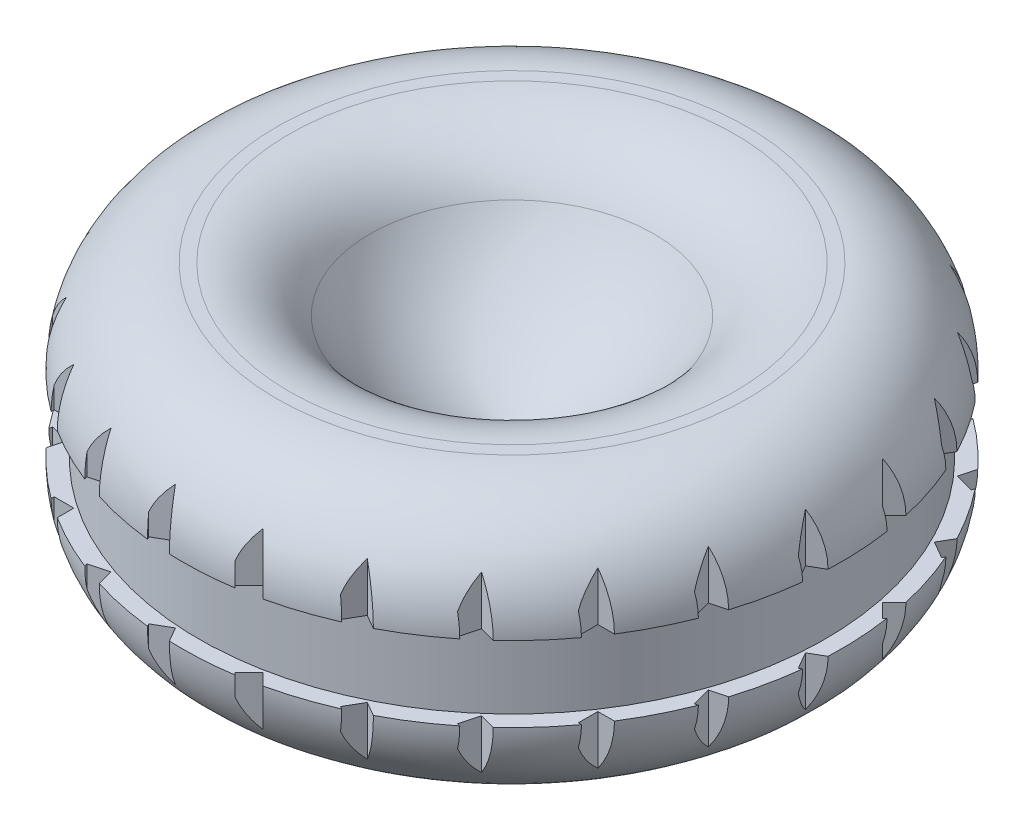
from build123d import *

# Parameters (mm, degrees)
SKETCH1_R                = 175
SKETCH1_R_2              = 6
BOSS_EXTRUDE1_DEPTH      = 140
FILLET4_R                = 50
SKETCH2_W                = 8.82126667
SKETCH2_H                = 40
SKETCH5_W                = 10.739457823
SKETCH5_H                = 10.396834474
CUT_EXTRUDE4_DEPTH       = 102
CIRPATTERN1_START        = -103.927560019
CIRPATTERN1_OUTLINE_W    = 20.879049746
CIRPATTERN1_OUTLINE_H    = 28
CIRPATTERN1_DEPTH        = 10.396834474
CIRPATTERN1_START_2      = 93.530725545
CIRPATTERN1_2_OUTLINE_W  = 9.879049746
CIRPATTERN1_2_OUTLINE_H  = 28
CIRPATTERN1_2_DEPTH      = 10.396834474
CIRPATTERN1_START_3      = -147.908767196
CIRPATTERN1_3_OUTLINE_W  = 10.396834474
CIRPATTERN1_3_OUTLINE_H  = 28
CIRPATTERN1_3_DEPTH      = 8.787816942
CIRPATTERN1_START_4      = 139.120950254
CIRPATTERN1_4_OUTLINE_W  = 10.396834474
CIRPATTERN1_4_OUTLINE_H  = 28
CIRPATTERN1_4_DEPTH      = 8.787816935
CIRPATTERN1_5_OUTLINE_W  = 32.879049746
CIRPATTERN1_5_OUTLINE_H  = 28
CIRPATTERN1_5_DEPTH      = 10.396834474
CIRPATTERN1_6_OUTLINE_W  = 31.879049746
CIRPATTERN1_6_OUTLINE_H  = 28
CIRPATTERN1_6_DEPTH      = 10.396834474
CIRPATTERN1_7_OUTLINE_W  = 10.396834474
CIRPATTERN1_7_OUTLINE_H  = 28
CIRPATTERN1_7_DEPTH      = 8.787816942
CIRPATTERN1_8_OUTLINE_W  = 10.396834474
CIRPATTERN1_8_OUTLINE_H  = 28
CIRPATTERN1_8_DEPTH      = 8.787816935
CIRPATTERN1_9_OUTLINE_W  = 29.879049746
CIRPATTERN1_9_OUTLINE_H  = 28
CIRPATTERN1_9_DEPTH      = 10.396834474
CIRPATTERN1_10_OUTLINE_W = 28.879049746
CIRPATTERN1_10_OUTLINE_H = 28
CIRPATTERN1_10_DEPTH     = 10.396834474
CIRPATTERN1_11_OUTLINE_W = 10.396834474
CIRPATTERN1_11_OUTLINE_H = 28
CIRPATTERN1_11_DEPTH     = 8.787816942
CIRPATTERN1_12_OUTLINE_W = 10.396834474
CIRPATTERN1_12_OUTLINE_H = 28
CIRPATTERN1_12_DEPTH     = 8.787816935
CIRPATTERN1_13_OUTLINE_W = 34.879049746
CIRPATTERN1_13_OUTLINE_H = 28
CIRPATTERN1_13_DEPTH     = 10.396834474
CIRPATTERN1_14_OUTLINE_W = 14.879049746
CIRPATTERN1_14_OUTLINE_H = 28
CIRPATTERN1_14_DEPTH     = 10.396834474
CIRPATTERN1_15_OUTLINE_W = 10.396834474
CIRPATTERN1_15_OUTLINE_H = 28
CIRPATTERN1_15_DEPTH     = 8.787816942
CIRPATTERN1_16_OUTLINE_W = 10.396834474
CIRPATTERN1_16_OUTLINE_H = 28
CIRPATTERN1_16_DEPTH     = 8.787816935
CIRPATTERN1_17_OUTLINE_W = 33.879049746
CIRPATTERN1_17_OUTLINE_H = 28
CIRPATTERN1_17_DEPTH     = 10.396834474
CIRPATTERN1_18_OUTLINE_W = 9.879049746
CIRPATTERN1_18_OUTLINE_H = 28
CIRPATTERN1_18_DEPTH     = 10.396834474
CIRPATTERN1_19_OUTLINE_W = 10.396834474
CIRPATTERN1_19_OUTLINE_H = 28
CIRPATTERN1_19_DEPTH     = 8.787816942
CIRPATTERN1_20_OUTLINE_W = 10.396834474
CIRPATTERN1_20_OUTLINE_H = 28
CIRPATTERN1_20_DEPTH     = 8.787816935
CIRPATTERN1_21_OUTLINE_W = 28
CIRPATTERN1_21_OUTLINE_H = 23.879049746
CIRPATTERN1_21_DEPTH     = 10.396834474
CIRPATTERN1_22_OUTLINE_W = 28
CIRPATTERN1_22_OUTLINE_H = 9.879049746
CIRPATTERN1_22_DEPTH     = 10.396834474
CIRPATTERN1_START_5      = -147.90876718
CIRPATTERN1_23_OUTLINE_W = 28
CIRPATTERN1_23_OUTLINE_H = 10.396834474
CIRPATTERN1_23_DEPTH     = 8.787816926
FILLET5_R                = 50


# Read off the part's stored shape, not the designer's step: CirPattern1
with BuildPart() as part:
    # Sketch1 → Boss-Extrude1 (new body)
    with BuildSketch(Plane(origin=(0, 0, 0), x_dir=(1, 0, 0), z_dir=(0, 1, 0))):
        with Locations(Location((0, 0, 0), (0, 0, 270))):
            Circle(SKETCH1_R)
        with Locations(Location((0, 0, 0), (0, 0, 270))):
            Circle(SKETCH1_R_2, mode=Mode.SUBTRACT)
    extrude(amount=BOSS_EXTRUDE1_DEPTH)

    # Fillet4
    fillet4_edges = [part.edges().sort_by_distance(p)[0] for p in [
        (0, 0, -175),
        (0, 140, -175),
    ]]
    fillet(fillet4_edges, radius=FILLET4_R)

    # Sketch2 → Cut-Revolve1 (revolve, cut)
    with BuildSketch(Plane(origin=(0, 0, 0), x_dir=(0, 0, -1), z_dir=(1, 0, 0)), mode=Mode.PRIVATE) as cut_revolve1_sk:
        with Locations((170.589366665, 70)):
            Rectangle(SKETCH2_W, SKETCH2_H)
    revolve(cut_revolve1_sk.sketch.rotate(Axis((0, 0, 0), (0, 1, 0)), 180), axis=Axis((0, 0, 0), (0, 1, 0)), mode=Mode.SUBTRACT)

    # Sketch5 → Cut-Extrude4 (cut, symmetric)
    with BuildSketch(Plane(origin=(0, 50, 0), x_dir=(1, 0, 0), z_dir=(0, 1, 0))):
        with Locations((144.490679166, -98.729142782)):
            Rectangle(SKETCH5_W, SKETCH5_H)
    extrude(amount=CUT_EXTRUDE4_DEPTH, both=True, mode=Mode.SUBTRACT)

    # CirPattern1 outline → CirPattern1 (cut)
    with BuildSketch(Plane(origin=(0, 0, 0), x_dir=(0.9659258262890682, 0, -0.2588190451025211), z_dir=(0.2588190451025211, 0, 0.9659258262890682)).offset(CIRPATTERN1_START)):
        with Locations((-149.560475127, 104)):
            Rectangle(CIRPATTERN1_OUTLINE_W, CIRPATTERN1_OUTLINE_H)
        with Locations((-149.560475127, 36)):
            Rectangle(CIRPATTERN1_OUTLINE_W, CIRPATTERN1_OUTLINE_H)
    extrude(amount=CIRPATTERN1_DEPTH, mode=Mode.SUBTRACT)

    # CirPattern1 2 outline → CirPattern1 2 (cut)
    with BuildSketch(Plane(origin=(0, 0, 0), x_dir=(0.9659258262890682, 0, -0.2588190451025211), z_dir=(0.2588190451025211, 0, 0.9659258262890682)).offset(CIRPATTERN1_START_2)):
        with Locations((144.060475127, 104)):
            Rectangle(CIRPATTERN1_2_OUTLINE_W, CIRPATTERN1_2_OUTLINE_H)
        with Locations((144.060475127, 36)):
            Rectangle(CIRPATTERN1_2_OUTLINE_W, CIRPATTERN1_2_OUTLINE_H)
    extrude(amount=CIRPATTERN1_2_DEPTH, mode=Mode.SUBTRACT)

    # CirPattern1 3 outline → CirPattern1 3 (cut)
    with BuildSketch(Plane(origin=(0, 0, 0), x_dir=(0.9659258262890682, 0, -0.2588190451025211), z_dir=(0.2588190451025211, 0, 0.9659258262890682)).offset(CIRPATTERN1_START_3)):
        with Locations((98.729142782, 104)):
            Rectangle(CIRPATTERN1_3_OUTLINE_W, CIRPATTERN1_3_OUTLINE_H)
        with Locations((98.729142782, 36)):
            Rectangle(CIRPATTERN1_3_OUTLINE_W, CIRPATTERN1_3_OUTLINE_H)
    extrude(amount=CIRPATTERN1_3_DEPTH, mode=Mode.SUBTRACT)

    # CirPattern1 4 outline → CirPattern1 4 (cut)
    with BuildSketch(Plane(origin=(0, 0, 0), x_dir=(0.9659258262890682, 0, -0.2588190451025211), z_dir=(0.2588190451025211, 0, 0.9659258262890682)).offset(CIRPATTERN1_START_4)):
        with Locations((-98.729142782, 104)):
            Rectangle(CIRPATTERN1_4_OUTLINE_W, CIRPATTERN1_4_OUTLINE_H)
        with Locations((-98.729142782, 36)):
            Rectangle(CIRPATTERN1_4_OUTLINE_W, CIRPATTERN1_4_OUTLINE_H)
    extrude(amount=CIRPATTERN1_4_DEPTH, mode=Mode.SUBTRACT)

    # CirPattern1 5 outline → CirPattern1 5 (cut)
    with BuildSketch(Plane(origin=(0, 0, 0), x_dir=(0.9659258262890716, 0, 0.25881904510250797), z_dir=(0.25881904510250797, 0, -0.9659258262890718)).offset(CIRPATTERN1_START_2)):
        with Locations((-155.560475127, -104)):
            Rectangle(CIRPATTERN1_5_OUTLINE_W, CIRPATTERN1_5_OUTLINE_H)
        with Locations((-155.560475127, -36)):
            Rectangle(CIRPATTERN1_5_OUTLINE_W, CIRPATTERN1_5_OUTLINE_H)
    extrude(amount=CIRPATTERN1_5_DEPTH, mode=Mode.SUBTRACT)

    # CirPattern1 6 outline → CirPattern1 6 (cut)
    with BuildSketch(Plane(origin=(0, 0, 0), x_dir=(0.9659258262890716, 0, 0.25881904510250797), z_dir=(0.25881904510250797, 0, -0.9659258262890718)).offset(CIRPATTERN1_START)):
        with Locations((155.060475127, -104)):
            Rectangle(CIRPATTERN1_6_OUTLINE_W, CIRPATTERN1_6_OUTLINE_H)
        with Locations((155.060475127, -36)):
            Rectangle(CIRPATTERN1_6_OUTLINE_W, CIRPATTERN1_6_OUTLINE_H)
    extrude(amount=CIRPATTERN1_6_DEPTH, mode=Mode.SUBTRACT)

    # CirPattern1 7 outline → CirPattern1 7 (cut)
    with BuildSketch(Plane(origin=(0, 0, 0), x_dir=(0.9659258262890716, 0, 0.25881904510250797), z_dir=(0.25881904510250797, 0, -0.9659258262890718)).offset(CIRPATTERN1_START_3)):
        with Locations((-98.729142782, -104)):
            Rectangle(CIRPATTERN1_7_OUTLINE_W, CIRPATTERN1_7_OUTLINE_H)
        with Locations((-98.729142782, -36)):
            Rectangle(CIRPATTERN1_7_OUTLINE_W, CIRPATTERN1_7_OUTLINE_H)
    extrude(amount=CIRPATTERN1_7_DEPTH, mode=Mode.SUBTRACT)

    # CirPattern1 8 outline → CirPattern1 8 (cut)
    with BuildSketch(Plane(origin=(0, 0, 0), x_dir=(0.9659258262890716, 0, 0.25881904510250797), z_dir=(0.25881904510250797, 0, -0.9659258262890718)).offset(CIRPATTERN1_START_4)):
        with Locations((98.729142782, -104)):
            Rectangle(CIRPATTERN1_8_OUTLINE_W, CIRPATTERN1_8_OUTLINE_H)
        with Locations((98.729142782, -36)):
            Rectangle(CIRPATTERN1_8_OUTLINE_W, CIRPATTERN1_8_OUTLINE_H)
    extrude(amount=CIRPATTERN1_8_DEPTH, mode=Mode.SUBTRACT)

    # CirPattern1 9 outline → CirPattern1 9 (cut)
    with BuildSketch(Plane(origin=(0, 0, 0), x_dir=(0.8660254037844449, 0, 0.49999999999998906), z_dir=(0.499999999999989, 0, -0.866025403784445)).offset(CIRPATTERN1_START_2)):
        with Locations((-154.060475127, -104)):
            Rectangle(CIRPATTERN1_9_OUTLINE_W, CIRPATTERN1_9_OUTLINE_H)
        with Locations((-154.060475127, -36)):
            Rectangle(CIRPATTERN1_9_OUTLINE_W, CIRPATTERN1_9_OUTLINE_H)
    extrude(amount=CIRPATTERN1_9_DEPTH, mode=Mode.SUBTRACT)

    # CirPattern1 10 outline → CirPattern1 10 (cut)
    with BuildSketch(Plane(origin=(0, 0, 0), x_dir=(0.8660254037844449, 0, 0.49999999999998906), z_dir=(0.499999999999989, 0, -0.866025403784445)).offset(CIRPATTERN1_START)):
        with Locations((153.560475127, -104)):
            Rectangle(CIRPATTERN1_10_OUTLINE_W, CIRPATTERN1_10_OUTLINE_H)
        with Locations((153.560475127, -36)):
            Rectangle(CIRPATTERN1_10_OUTLINE_W, CIRPATTERN1_10_OUTLINE_H)
    extrude(amount=CIRPATTERN1_10_DEPTH, mode=Mode.SUBTRACT)

    # CirPattern1 11 outline → CirPattern1 11 (cut)
    with BuildSketch(Plane(origin=(0, 0, 0), x_dir=(0.8660254037844449, 0, 0.49999999999998906), z_dir=(0.499999999999989, 0, -0.866025403784445)).offset(CIRPATTERN1_START_3)):
        with Locations((-98.729142782, -104)):
            Rectangle(CIRPATTERN1_11_OUTLINE_W, CIRPATTERN1_11_OUTLINE_H)
        with Locations((-98.729142782, -36)):
            Rectangle(CIRPATTERN1_11_OUTLINE_W, CIRPATTERN1_11_OUTLINE_H)
    extrude(amount=CIRPATTERN1_11_DEPTH, mode=Mode.SUBTRACT)

    # CirPattern1 12 outline → CirPattern1 12 (cut)
    with BuildSketch(Plane(origin=(0, 0, 0), x_dir=(0.8660254037844449, 0, 0.49999999999998906), z_dir=(0.499999999999989, 0, -0.866025403784445)).offset(CIRPATTERN1_START_4)):
        with Locations((98.729142782, -104)):
            Rectangle(CIRPATTERN1_12_OUTLINE_W, CIRPATTERN1_12_OUTLINE_H)
        with Locations((98.729142782, -36)):
            Rectangle(CIRPATTERN1_12_OUTLINE_W, CIRPATTERN1_12_OUTLINE_H)
    extrude(amount=CIRPATTERN1_12_DEPTH, mode=Mode.SUBTRACT)

    # CirPattern1 13 outline → CirPattern1 13 (cut)
    with BuildSketch(Plane(origin=(0, 0, 0), x_dir=(0.707106781186556, 0, 0.707106781186539), z_dir=(0.707106781186539, 0, -0.707106781186556)).offset(CIRPATTERN1_START_2)):
        with Locations((-156.560475127, -104)):
            Rectangle(CIRPATTERN1_13_OUTLINE_W, CIRPATTERN1_13_OUTLINE_H)
        with Locations((-156.560475127, -36)):
            Rectangle(CIRPATTERN1_13_OUTLINE_W, CIRPATTERN1_13_OUTLINE_H)
    extrude(amount=CIRPATTERN1_13_DEPTH, mode=Mode.SUBTRACT)

    # CirPattern1 14 outline → CirPattern1 14 (cut)
    with BuildSketch(Plane(origin=(0, 0, 0), x_dir=(0.707106781186556, 0, 0.707106781186539), z_dir=(0.707106781186539, 0, -0.707106781186556)).offset(CIRPATTERN1_START)):
        with Locations((146.560475127, -104)):
            Rectangle(CIRPATTERN1_14_OUTLINE_W, CIRPATTERN1_14_OUTLINE_H)
        with Locations((146.560475127, -36)):
            Rectangle(CIRPATTERN1_14_OUTLINE_W, CIRPATTERN1_14_OUTLINE_H)
    extrude(amount=CIRPATTERN1_14_DEPTH, mode=Mode.SUBTRACT)

    # CirPattern1 15 outline → CirPattern1 15 (cut)
    with BuildSketch(Plane(origin=(0, 0, 0), x_dir=(0.707106781186556, 0, 0.707106781186539), z_dir=(0.707106781186539, 0, -0.707106781186556)).offset(CIRPATTERN1_START_3)):
        with Locations((-98.729142782, -104)):
            Rectangle(CIRPATTERN1_15_OUTLINE_W, CIRPATTERN1_15_OUTLINE_H)
        with Locations((-98.729142782, -36)):
            Rectangle(CIRPATTERN1_15_OUTLINE_W, CIRPATTERN1_15_OUTLINE_H)
    extrude(amount=CIRPATTERN1_15_DEPTH, mode=Mode.SUBTRACT)

    # CirPattern1 16 outline → CirPattern1 16 (cut)
    with BuildSketch(Plane(origin=(0, 0, 0), x_dir=(0.707106781186556, 0, 0.707106781186539), z_dir=(0.707106781186539, 0, -0.707106781186556)).offset(CIRPATTERN1_START_4)):
        with Locations((98.729142782, -104)):
            Rectangle(CIRPATTERN1_16_OUTLINE_W, CIRPATTERN1_16_OUTLINE_H)
        with Locations((98.729142782, -36)):
            Rectangle(CIRPATTERN1_16_OUTLINE_W, CIRPATTERN1_16_OUTLINE_H)
    extrude(amount=CIRPATTERN1_16_DEPTH, mode=Mode.SUBTRACT)

    # CirPattern1 17 outline → CirPattern1 17 (cut)
    with BuildSketch(Plane(origin=(0, 0, 0), x_dir=(0.5000000000000098, 0, 0.8660254037844329), z_dir=(0.8660254037844329, 0, -0.50000000000001)).offset(CIRPATTERN1_START_2)):
        with Locations((-156.060475127, -104)):
            Rectangle(CIRPATTERN1_17_OUTLINE_W, CIRPATTERN1_17_OUTLINE_H)
        with Locations((-156.060475127, -36)):
            Rectangle(CIRPATTERN1_17_OUTLINE_W, CIRPATTERN1_17_OUTLINE_H)
    extrude(amount=CIRPATTERN1_17_DEPTH, mode=Mode.SUBTRACT)

    # CirPattern1 18 outline → CirPattern1 18 (cut)
    with BuildSketch(Plane(origin=(0, 0, 0), x_dir=(0.5000000000000098, 0, 0.8660254037844329), z_dir=(0.8660254037844329, 0, -0.50000000000001)).offset(CIRPATTERN1_START)):
        with Locations((144.060475127, -104)):
            Rectangle(CIRPATTERN1_18_OUTLINE_W, CIRPATTERN1_18_OUTLINE_H)
        with Locations((144.060475127, -36)):
            Rectangle(CIRPATTERN1_18_OUTLINE_W, CIRPATTERN1_18_OUTLINE_H)
    extrude(amount=CIRPATTERN1_18_DEPTH, mode=Mode.SUBTRACT)

    # CirPattern1 19 outline → CirPattern1 19 (cut)
    with BuildSketch(Plane(origin=(0, 0, 0), x_dir=(0.5000000000000098, 0, 0.8660254037844329), z_dir=(0.8660254037844329, 0, -0.50000000000001)).offset(CIRPATTERN1_START_3)):
        with Locations((-98.729142782, -104)):
            Rectangle(CIRPATTERN1_19_OUTLINE_W, CIRPATTERN1_19_OUTLINE_H)
        with Locations((-98.729142782, -36)):
            Rectangle(CIRPATTERN1_19_OUTLINE_W, CIRPATTERN1_19_OUTLINE_H)
    extrude(amount=CIRPATTERN1_19_DEPTH, mode=Mode.SUBTRACT)

    # CirPattern1 20 outline → CirPattern1 20 (cut)
    with BuildSketch(Plane(origin=(0, 0, 0), x_dir=(0.5000000000000098, 0, 0.8660254037844329), z_dir=(0.8660254037844329, 0, -0.50000000000001)).offset(CIRPATTERN1_START_4)):
        with Locations((98.729142782, -104)):
            Rectangle(CIRPATTERN1_20_OUTLINE_W, CIRPATTERN1_20_OUTLINE_H)
        with Locations((98.729142782, -36)):
            Rectangle(CIRPATTERN1_20_OUTLINE_W, CIRPATTERN1_20_OUTLINE_H)
    extrude(amount=CIRPATTERN1_20_DEPTH, mode=Mode.SUBTRACT)

    # CirPattern1 21 outline → CirPattern1 21 (cut)
    with BuildSketch(Plane.YZ.offset(CIRPATTERN1_START)):
        with Locations((104, 151.060475127)):
            Rectangle(CIRPATTERN1_21_OUTLINE_W, CIRPATTERN1_21_OUTLINE_H)
        with Locations((36, 151.060475127)):
            Rectangle(CIRPATTERN1_21_OUTLINE_W, CIRPATTERN1_21_OUTLINE_H)
    extrude(amount=CIRPATTERN1_21_DEPTH, mode=Mode.SUBTRACT)

    # CirPattern1 22 outline → CirPattern1 22 (cut)
    with BuildSketch(Plane.YZ.offset(CIRPATTERN1_START_2)):
        with Locations((104, -144.060475127)):
            Rectangle(CIRPATTERN1_22_OUTLINE_W, CIRPATTERN1_22_OUTLINE_H)
        with Locations((36, -144.060475127)):
            Rectangle(CIRPATTERN1_22_OUTLINE_W, CIRPATTERN1_22_OUTLINE_H)
    extrude(amount=CIRPATTERN1_22_DEPTH, mode=Mode.SUBTRACT)

    # CirPattern1 23 outline → CirPattern1 23 (cut)
    with BuildSketch(Plane.YZ.offset(CIRPATTERN1_START_5)):
        with Locations((104, -98.729142782)):
            Rectangle(CIRPATTERN1_23_OUTLINE_W, CIRPATTERN1_23_OUTLINE_H)
        with Locations((36, -98.729142782)):
            Rectangle(CIRPATTERN1_23_OUTLINE_W, CIRPATTERN1_23_OUTLINE_H)
    extrude(amount=CIRPATTERN1_23_DEPTH, mode=Mode.SUBTRACT)

    # Sketch6 → Cut-Revolve2 (revolve, cut)
    with BuildSketch(Plane.XY, mode=Mode.PRIVATE) as cut_revolve2_sk:
        with BuildLine():
            Line((86.922587979, 140), (6, 140))
            Line((6, 140), (6, 61.575009481))
            add(Edge.make_bspline(
                [(86.922587979, 140), (65.061987982, 80.524910116), (6, 61.575009481)],
                knots=[0, 0, 0, 1, 1, 1], degree=2))
        make_face()
    revolve(cut_revolve2_sk.sketch.rotate(Axis((0, 259.547897443, 0), (0, -1, 0)), 90), axis=Axis((0, 259.547897443, 0), (0, -1, 0)), mode=Mode.SUBTRACT)

    # Fillet5
    fillet5_edges = [part.edges().sort_by_distance(p)[0] for p in [
        (0, 140, -86.922587979),
    ]]
    fillet(fillet5_edges, radius=FILLET5_R)


solid = part.part
